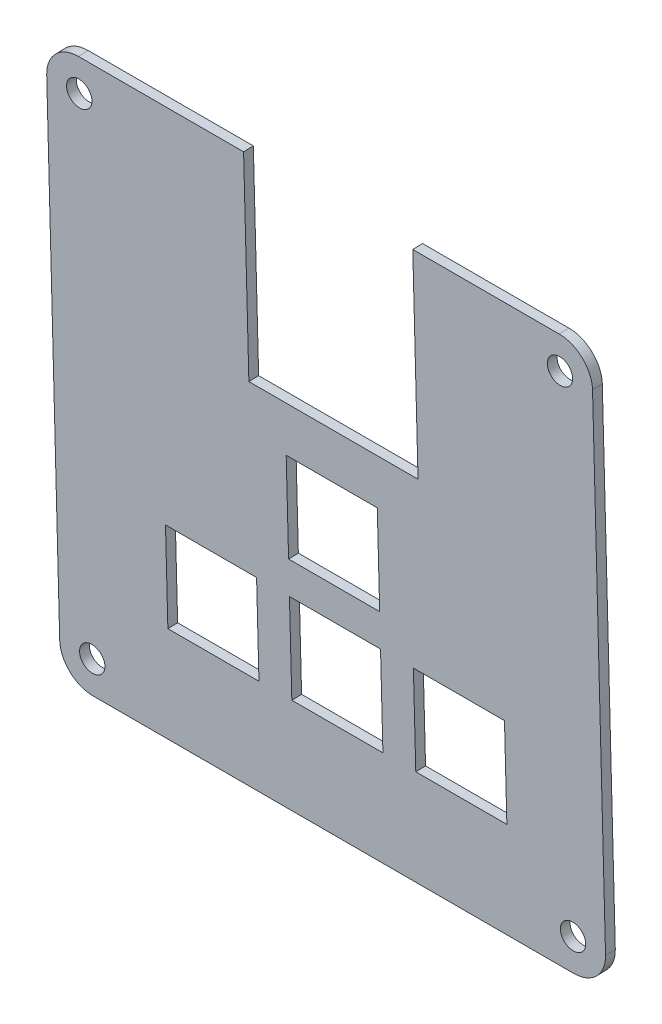
from build123d import *

# Parameters (mm, degrees)
SKETCH2_R             = 1.95
BOSS_EXTRUDE3_DEPTH   = 1.5
FILLET4_R             = 5
BODY_MOVE_COPY1_ANGLE = 91.5
BODY_MOVE_COPY2_ANGLE = 180
SKETCH3_W             = 14
SKETCH3_H             = 14
CUT_EXTRUDE6_DEPTH    = 10


with BuildPart() as part:
    # Sketch2 → Boss-Extrude3 (new body)
    with BuildSketch(Plane(origin=(0, 0, 0), x_dir=(1, 0, 0), z_dir=(0, 1, 0))):
        Polygon((43.198193182, -31.056403409), (43.198193182, 55.223596591), (12.808193182, 55.223596591), (12.808193182, 24.223596591), (-13.191806818, 24.223596591), (-13.191806818, 55.223596591), (-40.691806818, 55.223596591), (-40.691806818, -31.056403409), align=None)
        with Locations((-35.691806818, -26.056403409)):
            Circle(SKETCH2_R, mode=Mode.SUBTRACT)
        with Locations((38.198193182, -26.056403409)):
            Circle(SKETCH2_R, mode=Mode.SUBTRACT)
        with Locations((-35.691806818, 50.223596591)):
            Circle(SKETCH2_R, mode=Mode.SUBTRACT)
        with Locations((38.198193182, 50.223596591)):
            Circle(SKETCH2_R, mode=Mode.SUBTRACT)
    extrude(amount=BOSS_EXTRUDE3_DEPTH)

    # Fillet4
    fillet4_edges = [part.edges().sort_by_distance(p)[0] for p in [
        (-40.691806818, 0.75, 31.056403409),
        (43.198193182, 0.75, 31.056403409),
        (43.198193182, 0.75, -55.223596591),
        (-40.691806818, 0.75, -55.223596591),
    ]]
    fillet(fillet4_edges, radius=FILLET4_R)


with BuildPart() as part_1:
    # Body-Move/Copy1: moved
    add(part.part.rotate(Axis((0, 0.75, -12.283596591), (-1, 0, 0)), BODY_MOVE_COPY1_ANGLE))


with BuildPart() as part_2:
    # Body-Move/Copy2: moved
    add(part_1.part.rotate(Axis((0.403193182, 0.75, 0), (0, 0, 1)), BODY_MOVE_COPY2_ANGLE))

    # Sketch3 → Cut-Extrude6 (cut)
    with BuildSketch(Plane(origin=(0, 0.341583523, -13.044548447), x_dir=(-1, 0, 0), z_dir=(-2.1436792936287095e-13, 0.026176948305881326, -0.9996573249756094))):
        with Locations((-19.598193182, -20.81180408)):
            Rectangle(SKETCH3_W, SKETCH3_H)
        with Locations((-0.548193182, -20.81180408)):
            Rectangle(SKETCH3_W, SKETCH3_H)
        with Locations((18.501806818, -20.81180408)):
            Rectangle(SKETCH3_W, SKETCH3_H)
        with Locations((-0.548193182, -1.76180408)):
            Rectangle(SKETCH3_W, SKETCH3_H)
    extrude(amount=-CUT_EXTRUDE6_DEPTH, mode=Mode.SUBTRACT)


solid = part_2.part
